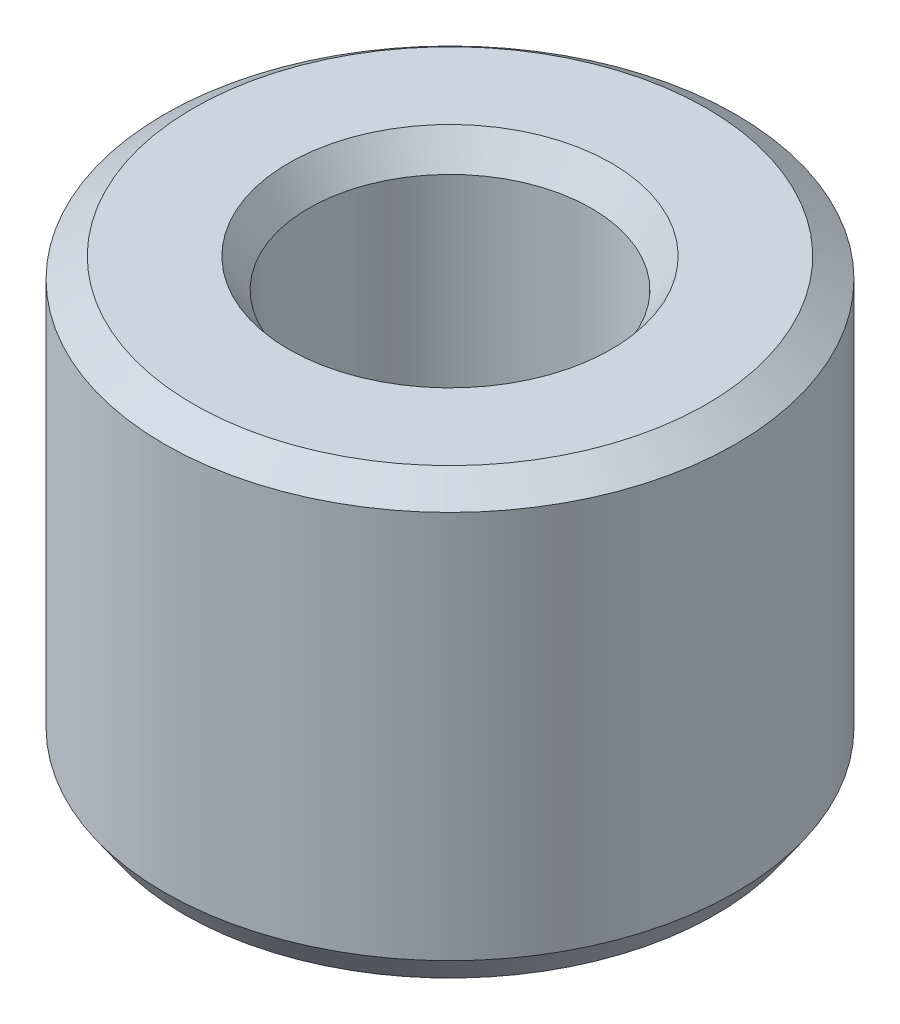
from build123d import *
from OCP.BRepFilletAPI import BRepFilletAPI_MakeChamfer

# Parameters (mm, degrees)
SKETCH1_R           = 50
BOSS_EXTRUDE1_DEPTH = 76.548668292
SKETCH2_R           = 24.746382788
CUT_EXTRUDE1_DEPTH  = 105.209877734
CHAMFER1_SIZE       = 3.494349475
CHAMFER1_SIZE2      = 5.100414771


with BuildPart() as part:
    # Sketch1 → Boss-Extrude1 (new body)
    with BuildSketch(Plane(origin=(0, 0, 0), x_dir=(1, 0, 0), z_dir=(0, 1, 0))):
        Circle(SKETCH1_R)
    extrude(amount=BOSS_EXTRUDE1_DEPTH)

    # Sketch2 → Cut-Extrude1 (cut, through all)
    with BuildSketch(Plane(origin=(0, 0, 0), x_dir=(1, 0, 0), z_dir=(0, 1, 0))):
        Circle(SKETCH2_R)
    extrude(amount=CUT_EXTRUDE1_DEPTH, mode=Mode.SUBTRACT)

    # Chamfer1: one chamfer whose edges measure the first distance from different faces: ONE call of the kernel's chamfer builder (chamfer() names one face for all edges)
    chamfer1_edges_1 = [part.edges().sort_by_distance(p)[0] for p in [
        (-24.746382788, 76.548668292, 0),
    ]]
    chamfer1_side_1 = [part.faces().sort_by_distance(p)[0] for p in [
        (-48.585786438, 76.548668292, 0),
    ]]
    chamfer1_edges_2 = [part.edges().sort_by_distance(p)[0] for p in [
        (-24.746382788, 0, 0),
    ]]
    chamfer1_side_2 = [part.faces().sort_by_distance(p)[0] for p in [
        (-24.746382788, 38.274334146, 0),
    ]]
    chamfer1_edges_3 = [part.edges().sort_by_distance(p)[0] for p in [
        (-50, 0, 0),
    ]]
    chamfer1_side_3 = [part.faces().sort_by_distance(p)[0] for p in [
        (-48.585786438, 0, 0),
    ]]
    chamfer1_edges_4 = [part.edges().sort_by_distance(p)[0] for p in [
        (-50, 76.548668292, 0),
    ]]
    chamfer1_side_4 = [part.faces().sort_by_distance(p)[0] for p in [
        (-50, 38.274334146, 0),
    ]]
    chamfer1 = BRepFilletAPI_MakeChamfer(part.part.solid().wrapped)
    for e in chamfer1_edges_1:
        chamfer1.Add(CHAMFER1_SIZE, CHAMFER1_SIZE2, e.wrapped, chamfer1_side_1[0].wrapped)  # the first distance lies on this face
    for e in chamfer1_edges_2:
        chamfer1.Add(CHAMFER1_SIZE, CHAMFER1_SIZE2, e.wrapped, chamfer1_side_2[0].wrapped)  # the first distance lies on this face
    for e in chamfer1_edges_3:
        chamfer1.Add(CHAMFER1_SIZE, CHAMFER1_SIZE2, e.wrapped, chamfer1_side_3[0].wrapped)  # the first distance lies on this face
    for e in chamfer1_edges_4:
        chamfer1.Add(CHAMFER1_SIZE, CHAMFER1_SIZE2, e.wrapped, chamfer1_side_4[0].wrapped)  # the first distance lies on this face
    add(Compound.cast(chamfer1.Shape()), mode=Mode.REPLACE)


solid = part.part
